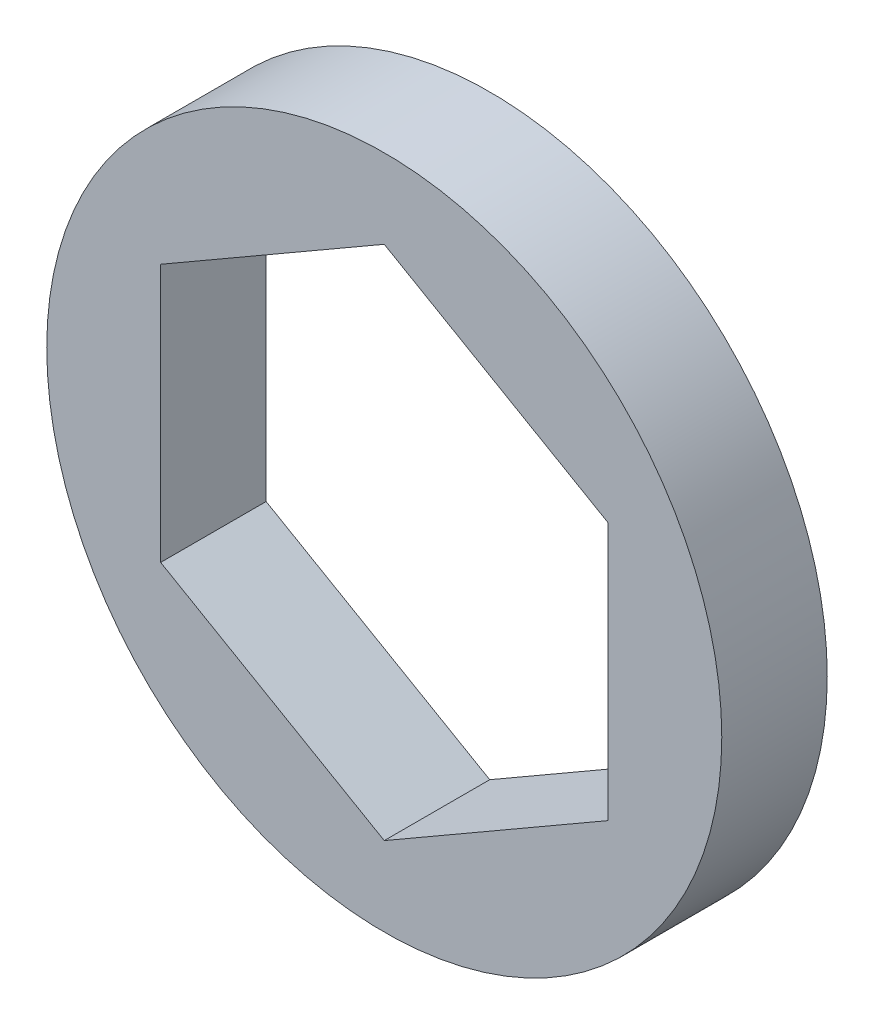
from build123d import *

# Parameters (mm, degrees)
SKETCH1_R           = 10.16
BOSS_EXTRUDE1_DEPTH = 1.5875


with BuildPart() as part:
    # Sketch1 → Boss-Extrude1 (new, symmetric)
    with BuildSketch(Plane.XY):
        Circle(SKETCH1_R)
        Polygon((0, 7.772289324), (-6.731, 3.886144662), (-6.731, -3.886144662), (0, -7.772289324), (6.731, -3.886144662), (6.731, 3.886144662), align=None, mode=Mode.SUBTRACT)
    extrude(amount=BOSS_EXTRUDE1_DEPTH, both=True)


solid = part.part
